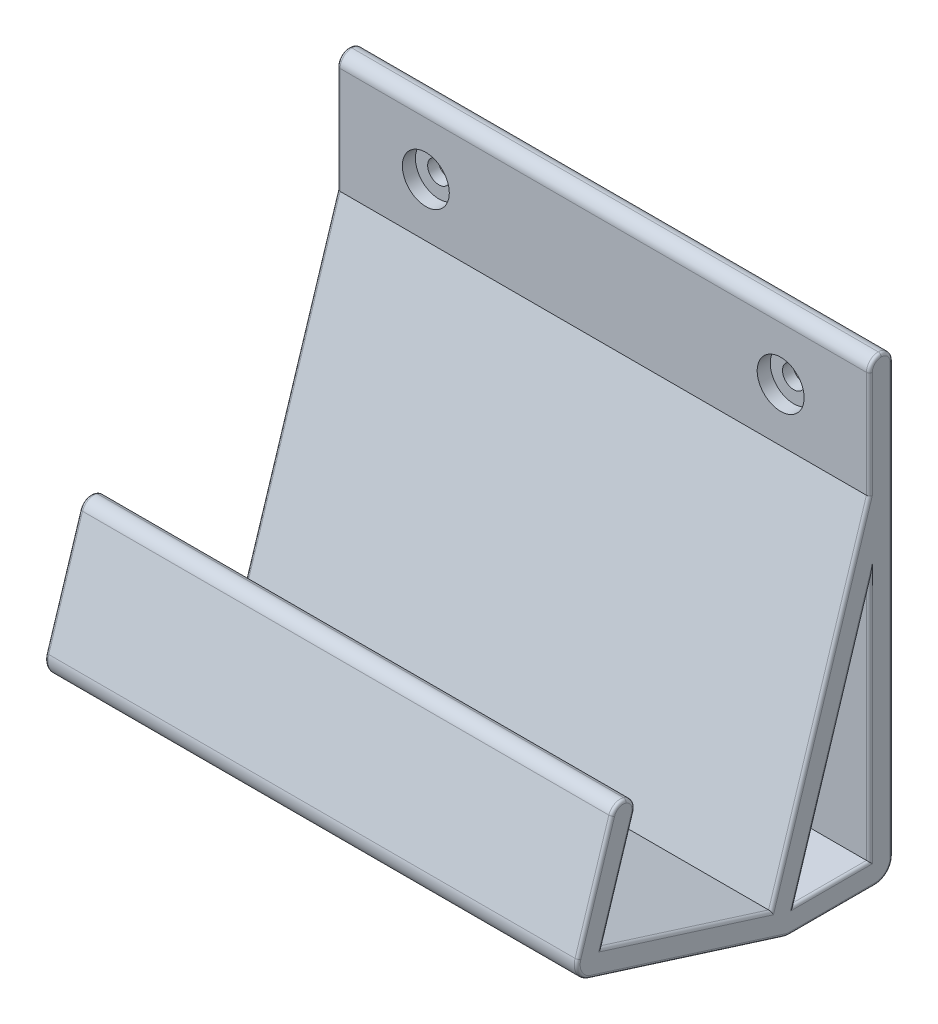
from build123d import *

# Parameters (mm, degrees)
BOSS_EXTRUDE1_DEPTH                                 = 45
CUT_EXTRUDE1_DEPTH                                  = 119.485655068
SKETCH3_W                                           = 90
SKETCH3_H                                           = 97.472123292
BOSS_EXTRUDE2_DEPTH                                 = 4
SKETCH4_W                                           = 17.926774368
SKETCH4_H                                           = 20
CUT_EXTRUDE2_DEPTH                                  = 121.335230998
SKETCH5_W                                           = 90
SKETCH5_H                                           = 17.926774368
BOSS_EXTRUDE3_DEPTH                                 = 4
FILLET7_R                                           = 3
FILLET8_R                                           = 2
FILLET9_R                                           = 0.5
CBORE_FOR_6_BINDING_HEAD_MACHINE_SCREW1_D           = 3.7973
CBORE_FOR_6_BINDING_HEAD_MACHINE_SCREW1_CBORE_D     = 7.9375
CBORE_FOR_6_BINDING_HEAD_MACHINE_SCREW1_CBORE_DEPTH = 2.2098


with BuildPart() as part:
    # Sketch1 → Boss-Extrude1 (new, symmetric)
    with BuildSketch(Plane(origin=(0, 0, 0), x_dir=(0, 0, -1), z_dir=(1, 0, 0))):
        Polygon((-22.597392532, 28.095513), (-28.611508522, 9.021173985), (0, 0), (16.538818973, 52.454432291), (26.538818973, 52.454432291), (55.495428229, -3.170696548), (56.456912684, -5.017691001), (51.947384896, -5.017691001), (24.111559387, 48.454432291), (19.471740318, 48.454432291), (2.612044605, -5.017691001), (-33.629199523, 6.40912938), (-26.412260335, 29.298336198), align=None)
    extrude(amount=BOSS_EXTRUDE1_DEPTH, both=True)

    # Sketch2 → Cut-Extrude1 (cut, through all)
    with BuildSketch(Plane(origin=(45, 0, 0), x_dir=(0, 0, -1), z_dir=(1, 0, 0))):
        Polygon((16.538818973, 52.454432291), (16.538818973, 39.152394197), (19.471740318, 48.454432291), (24.111559387, 48.454432291), (51.947384896, -5.017691001), (56.456912684, -5.017691001), (26.538818973, 52.454432291), align=None)
    extrude(amount=-CUT_EXTRUDE1_DEPTH, mode=Mode.SUBTRACT)

    # Sketch3 → Boss-Extrude2 (add)
    with BuildSketch(Plane(origin=(0, 0, -16.538818973), x_dir=(-1, 0, 0), z_dir=(0, 0, -1))):
        with Locations((0, 23.718370645)):
            Rectangle(SKETCH3_W, SKETCH3_H)
    extrude(amount=BOSS_EXTRUDE2_DEPTH)

    # Sketch4 → Cut-Extrude2 (cut, through all)
    with BuildSketch(Plane.ZY.offset(45)):
        with Locations((-11.575431789, -15.017691001)):
            Rectangle(SKETCH4_W, SKETCH4_H)
    extrude(amount=-CUT_EXTRUDE2_DEPTH, mode=Mode.SUBTRACT)

    # Sketch5 → Boss-Extrude3 (add)
    with BuildSketch(Plane.XZ.offset(5.017691001)):
        with Locations((0, -11.575431789)):
            Rectangle(SKETCH5_W, SKETCH5_H)
    extrude(amount=-BOSS_EXTRUDE3_DEPTH)

    # Fillet7
    fillet7_edges = [part.edges().sort_by_distance(p)[0] for p in [
        (0, -5.017691001, -2.612044605),
        (0, 6.40912938, 33.629199523),
        (0, -5.017691001, -20.538818973),
    ]]
    fillet(fillet7_edges, radius=FILLET7_R)

    # Fillet8
    fillet8_edges = [part.edges().sort_by_distance(p)[0] for p in [
        (0, 72.454432291, -16.538818973),
        (0, 28.095513, 22.597392532),
        (0, 72.454432291, -20.538818973),
        (0, 29.298336198, 26.412260335),
    ]]
    fillet(fillet8_edges, radius=FILLET8_R - 0.0001)  # a hair under: the kernel refuses the full size

    # Fillet9
    fillet9_edges = [part.edges().sort_by_distance(p)[0] for p in [
        (-45, 19.067351598, -16.538818973),
        (-45, 19.067351598, -10.206029367),
        (45, 19.067351598, -10.206029367),
        (-45, -1.017691001, -10.206029367),
        (45, -1.017691001, -10.206029367),
        (-45, 34.218420645, -20.538818973),
        (-45, -5.017691001, -10.30630387),
        (-45, 0.314085064, 14.298188651),
        (-45, 6.982916994, 32.526963772),
        (-45, -4.982775532, -2.61741861),
        (-45, 17.604674228, 25.905141292),
        (-45, -4.139011345, -19.660139316),
        (45, -5.017691001, -10.30630387),
        (45, 0.314085064, 14.298188651),
        (45, 6.982916994, 32.526963772),
        (-45, 4.510586993, 14.305754261),
        (45, -4.982775532, -2.61741861),
        (45, -4.139011345, -19.660139316),
        (-45, 26.227216146, -8.269409486),
        (45, 34.218420645, -20.538818973),
        (45, 61.454482291, -16.538818973),
        (45, 18.33063895, 29.870361994),
        (45, 28.563549105, 26.029754386),
        (45, 27.71300705, 23.332179625),
        (45, 71.868675143, -19.953061824),
        (45, 71.868675143, -17.124576121),
        (-45, 18.33063895, 29.870361994),
        (-45, 28.563549105, 26.029754386),
        (-45, 27.71300705, 23.332179625),
        (-45, 71.868675143, -19.953061824),
        (-45, 71.868675143, -17.124576121),
        (45, 26.227216146, -8.269409486),
        (45, 4.510586993, 14.305754261),
        (45, 17.604674228, 25.905141292),
        (-45, 61.454482291, -16.538818973),
        (45, 19.067351598, -16.538818973),
    ]]
    fillet(fillet9_edges, radius=FILLET9_R)

    # CBORE for #6 Binding Head Machine Screw1 (through all)
    with Locations(Plane.XY.offset(-16.538818973)):
        with Locations((-30, 61.454432291), (30, 61.454432291)):
            CounterBoreHole(CBORE_FOR_6_BINDING_HEAD_MACHINE_SCREW1_D / 2, CBORE_FOR_6_BINDING_HEAD_MACHINE_SCREW1_CBORE_D / 2, CBORE_FOR_6_BINDING_HEAD_MACHINE_SCREW1_CBORE_DEPTH)


solid = part.part
